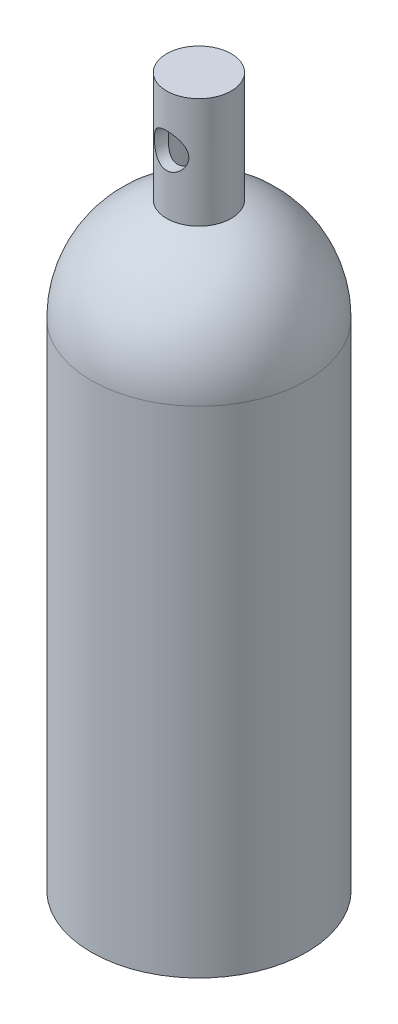
from build123d import *

# Parameters (mm, degrees)
SKETCH_TOOTHPASTE_TANK_R = 50
TOOTHPASTE_TANK_DEPTH    = 230
SHELL_TANK_SPACE_T       = -5
CUT_VALVE_REACH          = 242.624
SKETCH_VALVE_R           = 8


with BuildPart() as part:
    # Sketch_Toothpaste Tank → Toothpaste Tank (new body)
    with BuildSketch(Plane(origin=(0, 0, 0), x_dir=(1, 0, 0), z_dir=(0, 1, 0))):
        Circle(SKETCH_TOOTHPASTE_TANK_R)
    extrude(amount=-TOOTHPASTE_TANK_DEPTH)

    # Shell_Tank Space
    shell_tank_space_openings = [part.faces().sort_by_distance(p)[0] for p in [
        (0, 0, 0),
    ]]
    offset(amount=SHELL_TANK_SPACE_T, openings=shell_tank_space_openings, kind=Kind.INTERSECTION)

    # Sketch_Tank Top → Revolve_Tank Top (revolve)
    with BuildSketch(Plane(origin=(0, 0, 0), x_dir=(0, 0, -1), z_dir=(1, 0, 0))):
        with BuildLine():
            Line((-45, 0), (-50, 0))
            ThreePointArc((-50, 0), (-40.311288741, 29.580398915), (-15, 47.696960071))
            Line((-15, 47.696960071), (-15, 98.989794856))
            Line((-15, 98.989794856), (-10, 98.989794856))
            Line((-10, 98.989794856), (0, 98.989794856))
            Line((0, 98.989794856), (0, 93.874821937))
            Line((0, 93.874821937), (-10, 93.874821937))
            Line((-10, 93.874821937), (-10, 48.989794856))
            Line((-10, 48.989794856), (-10, 43.874821937))
            ThreePointArc((-10, 43.874821937), (-35.178118199, 28.062430401), (-45, 0))
        make_face()
    revolve(axis=Axis((0, 48.989794856, 0), (0, 1, 0)))

    # Sketch_Valve → Cut_Valve (cut, up to next)
    with BuildSketch(Plane.XY, mode=Mode.PRIVATE) as cut_valve_sk1:
        with Locations((0, 75)):
            Circle(SKETCH_VALVE_R)
    cut_valve_tool1 = extrude(cut_valve_sk1.sketch, amount=CUT_VALVE_REACH, mode=Mode.PRIVATE) & part.part
    add(cut_valve_tool1.solids().sort_by_distance((0, 75, 0))[0], mode=Mode.SUBTRACT)


solid = part.part
